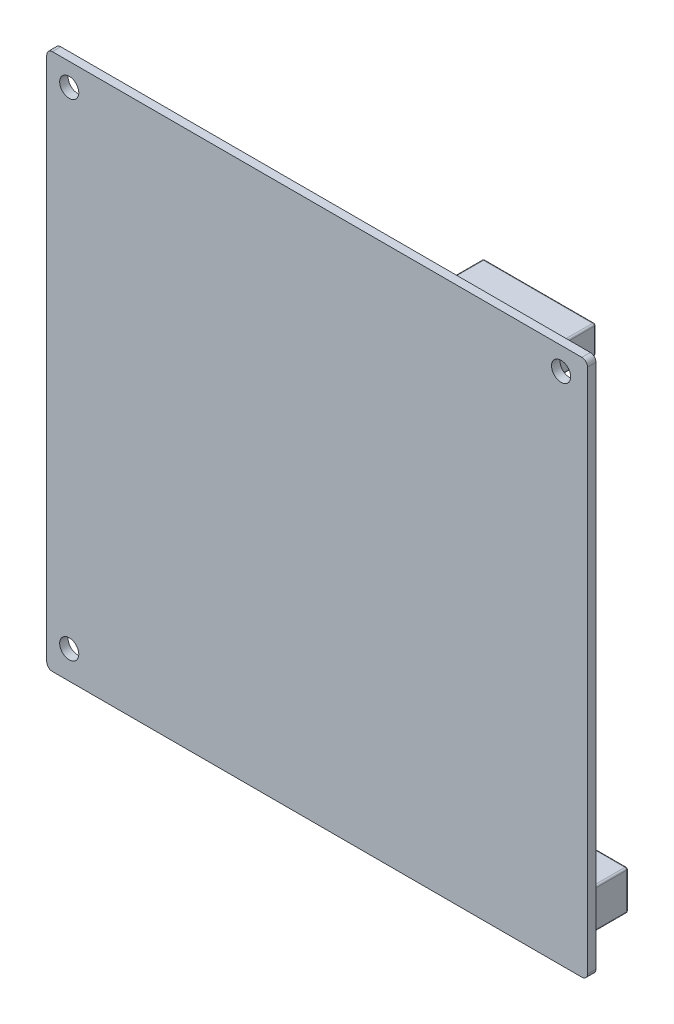
from build123d import *

# Parameters (mm, degrees)
SKETCH1_R           = 1.7
BOSS_EXTRUDE1_DEPTH = 1.5
SKETCH2_W           = 10
SKETCH2_H           = 7
BOSS_EXTRUDE2_DEPTH = 10
FILLET1_R           = 0.3
SKETCH3_R           = 3.5
SKETCH3_R_2         = 2.5
SKETCH3_W           = 5
SKETCH3_H           = 60
SKETCH3_W_2         = 20
SKETCH3_H_2         = 5
BOSS_EXTRUDE3_DEPTH = 10
FILLET2_R           = 0.3


with BuildPart() as part:
    # Sketch1 → Boss-Extrude1 (new body)
    with BuildSketch(Plane.XY):
        with BuildLine():
            Line((-47.1, 47.75), (47.1, 47.75))
            ThreePointArc((47.1, 47.75), (47.807106781, 47.457106781), (48.1, 46.75))
            Line((48.1, 46.75), (48.1, -46.75))
            ThreePointArc((48.1, -46.75), (47.807106781, -47.457106781), (47.1, -47.75))
            Line((47.1, -47.75), (-47.1, -47.75))
            ThreePointArc((-47.1, -47.75), (-47.807106781, -47.457106781), (-48.1, -46.75))
            Line((-48.1, -46.75), (-48.1, 46.75))
            ThreePointArc((-48.1, 46.75), (-47.807106781, 47.457106781), (-47.1, 47.75))
        make_face()
        with Locations((-44.1, 43.75)):
            Circle(SKETCH1_R, mode=Mode.SUBTRACT)
        with Locations((-44.1, -42.75)):
            Circle(SKETCH1_R, mode=Mode.SUBTRACT)
        with Locations((43.4, 43.75)):
            Circle(SKETCH1_R, mode=Mode.SUBTRACT)
    extrude(amount=BOSS_EXTRUDE1_DEPTH)

    # Sketch2 → Boss-Extrude2 (add)
    with BuildSketch(Plane(origin=(0, 0, 0), x_dir=(-1, 0, 0), z_dir=(0, 0, -1))):
        with Locations((-38.84642424, -41.693137568)):
            Rectangle(SKETCH2_W, SKETCH2_H)
    extrude(amount=BOSS_EXTRUDE2_DEPTH)

    # Fillet1
    fillet1_edges = [part.edges().sort_by_distance(p)[0] for p in [
        (43.84642424, -41.693137568, 0),
        (43.84642424, -38.193137568, -5),
        (38.84642424, -45.193137568, 0),
        (43.84642424, -45.193137568, -5),
        (33.84642424, -41.693137568, 0),
        (33.84642424, -45.193137568, -5),
        (38.84642424, -38.193137568, 0),
        (33.84642424, -38.193137568, -5),
        (43.84642424, -41.693137568, -10),
        (38.84642424, -45.193137568, -10),
        (33.84642424, -41.693137568, -10),
        (38.84642424, -38.193137568, -10),
    ]]
    fillet(fillet1_edges, radius=FILLET1_R)

    # Sketch3 → Boss-Extrude3 (add)
    with BuildSketch(Plane(origin=(0, 0, 0), x_dir=(-1, 0, 0), z_dir=(0, 0, -1))):
        with Locations(Location((-24.645786009, -38.910874107, 0), (0, 0, 180))):
            Circle(SKETCH3_R)
        with Locations(Location((-18.1, -38.910874107, 0), (0, 0, 180))):
            Circle(SKETCH3_R_2)
        with Locations((41.6, -2.25)):
            Rectangle(SKETCH3_W, SKETCH3_H)
        with Locations((-28.1, 40.25)):
            Rectangle(SKETCH3_W_2, SKETCH3_H_2)
        with Locations((-6.474280775, -41.410874107)):
            Rectangle(SKETCH3_W, SKETCH3_H_2)
    extrude(amount=BOSS_EXTRUDE3_DEPTH)

    # Fillet2
    # the kernel refuses this fillet: 0.3 mm, written as the material it adds along each edge
    with BuildSketch(Plane(origin=(24.645786009, -38.910874107, 0), x_dir=(1, 0, 0), z_dir=(0, 1, 0))) as fillet2_piece_1:
        with BuildLine():
            CenterArc((3.5 + FILLET2_R, FILLET2_R), FILLET2_R, 180, 90)
            Line((3.5, FILLET2_R), (3.5, 0))
            Line((3.5, 0), (3.5 + FILLET2_R, 0))
        make_face()
    revolve(axis=Axis((24.645786009, -38.910874107, 0), (0, 0, -1)))
    with BuildSketch(Plane(origin=(18.1, -38.910874107, 0), x_dir=(1, 0, 0), z_dir=(0, 1, 0))) as fillet2_piece_2:
        with BuildLine():
            CenterArc((2.5 + FILLET2_R, FILLET2_R), FILLET2_R, 180, 90)
            Line((2.5, FILLET2_R), (2.5, 0))
            Line((2.5, 0), (2.5 + FILLET2_R, 0))
        make_face()
    revolve(axis=Axis((18.1, -38.910874107, 0), (0, 0, -1)))
    # the kernel refuses this fillet: 0.3 mm, written as the material it takes off along each edge
    with BuildSketch(Plane(origin=(-39.4, 27.45, -9.7), x_dir=(0, 1, 0), z_dir=(1, 0, 0))) as fillet2_2_piece_1_section:
        Polygon((0, 0), (FILLET2_R, 0), (FILLET2_R, -FILLET2_R), (0, -FILLET2_R), align=None)
    fillet2_2_piece_1 = extrude(amount=FILLET2_R, mode=Mode.PRIVATE)
    fillet2_2_piece_1 = fillet2_2_piece_1 - Plane(origin=(-39.4, 27.45, -9.7), x_dir=(0, -0.7071067811865475, 0.7071067811865475), z_dir=(1, 0, 0)) * Sphere(FILLET2_R, mode=Mode.PRIVATE)
    add(fillet2_2_piece_1, mode=Mode.SUBTRACT)
    with BuildSketch(Plane(origin=(-39.4, -31.95, -9.7), x_dir=(0, -1, 0), z_dir=(1, 0, 0))) as fillet2_2_piece_2_section:
        Polygon((0, 0), (FILLET2_R, 0), (FILLET2_R, FILLET2_R), (0, FILLET2_R), align=None)
    fillet2_2_piece_2 = extrude(amount=FILLET2_R, mode=Mode.PRIVATE)
    fillet2_2_piece_2 = fillet2_2_piece_2 - Plane(origin=(-39.4, -31.95, -9.7), x_dir=(0, 0.7071067811865475, 0.7071067811865475), z_dir=(1, 0, 0)) * Sphere(FILLET2_R, mode=Mode.PRIVATE)
    add(fillet2_2_piece_2, mode=Mode.SUBTRACT)
    with BuildSketch(Plane(origin=(-43.8, -31.95, -9.7), x_dir=(-1, 0, 0), z_dir=(0, -1, 0))) as fillet2_2_piece_3_section:
        Polygon((0, 0), (FILLET2_R, 0), (FILLET2_R, FILLET2_R), (0, FILLET2_R), align=None)
    fillet2_2_piece_3 = extrude(amount=FILLET2_R, mode=Mode.PRIVATE)
    fillet2_2_piece_3 = fillet2_2_piece_3 - Plane(origin=(-43.8, -31.95, -9.7), x_dir=(0.7071067811865475, 0, 0.7071067811865475), z_dir=(0, -1, 0)) * Sphere(FILLET2_R, mode=Mode.PRIVATE)
    add(fillet2_2_piece_3, mode=Mode.SUBTRACT)
    with BuildSketch(Plane(origin=(-43.8, 27.45, -9.7), x_dir=(-1, 0, 0), z_dir=(0, 1, 0))) as fillet2_2_piece_4_section:
        Polygon((0, 0), (FILLET2_R, 0), (FILLET2_R, -FILLET2_R), (0, -FILLET2_R), align=None)
    fillet2_2_piece_4 = extrude(amount=FILLET2_R, mode=Mode.PRIVATE)
    fillet2_2_piece_4 = fillet2_2_piece_4 - Plane(origin=(-43.8, 27.45, -9.7), x_dir=(0.7071067811865475, 0, 0.7071067811865475), z_dir=(0, 1, 0)) * Sphere(FILLET2_R, mode=Mode.PRIVATE)
    add(fillet2_2_piece_4, mode=Mode.SUBTRACT)
    with BuildSketch(Plane(origin=(37.8, 42.45, -9.7), x_dir=(1, 0, 0), z_dir=(0, 0, -1))) as fillet2_2_piece_5_section:
        Polygon((0, 0), (FILLET2_R, 0), (FILLET2_R, -FILLET2_R), (0, -FILLET2_R), align=None)
    fillet2_2_piece_5 = extrude(amount=FILLET2_R, mode=Mode.PRIVATE)
    fillet2_2_piece_5 = fillet2_2_piece_5 - Plane(origin=(37.8, 42.45, -9.7), x_dir=(-0.7071067811865475, -0.7071067811865475, 0), z_dir=(0, 0, -1)) * Sphere(FILLET2_R, mode=Mode.PRIVATE)
    add(fillet2_2_piece_5, mode=Mode.SUBTRACT)
    with BuildSketch(Plane(origin=(37.8, 38.05, -9.7), x_dir=(0, -1, 0), z_dir=(1, 0, 0))) as fillet2_2_piece_6_section:
        Polygon((0, 0), (FILLET2_R, 0), (FILLET2_R, FILLET2_R), (0, FILLET2_R), align=None)
    fillet2_2_piece_6 = extrude(amount=FILLET2_R, mode=Mode.PRIVATE)
    fillet2_2_piece_6 = fillet2_2_piece_6 - Plane(origin=(37.8, 38.05, -9.7), x_dir=(0, 0.7071067811865475, 0.7071067811865475), z_dir=(1, 0, 0)) * Sphere(FILLET2_R, mode=Mode.PRIVATE)
    add(fillet2_2_piece_6, mode=Mode.SUBTRACT)
    with BuildSketch(Plane(origin=(18.4, 38.05, -9.7), x_dir=(0, -1, 0), z_dir=(-1, 0, 0))) as fillet2_2_piece_7_section:
        Polygon((0, 0), (FILLET2_R, 0), (FILLET2_R, -FILLET2_R), (0, -FILLET2_R), align=None)
    fillet2_2_piece_7 = extrude(amount=FILLET2_R, mode=Mode.PRIVATE)
    fillet2_2_piece_7 = fillet2_2_piece_7 - Plane(origin=(18.4, 38.05, -9.7), x_dir=(0, 0.7071067811865475, 0.7071067811865475), z_dir=(-1, 0, 0)) * Sphere(FILLET2_R, mode=Mode.PRIVATE)
    add(fillet2_2_piece_7, mode=Mode.SUBTRACT)
    with BuildSketch(Plane(origin=(18.4, 42.45, -9.7), x_dir=(0, 0, -1), z_dir=(-1, 0, 0))) as fillet2_2_piece_8_section:
        Polygon((0, 0), (FILLET2_R, 0), (FILLET2_R, -FILLET2_R), (0, -FILLET2_R), align=None)
    fillet2_2_piece_8 = extrude(amount=FILLET2_R, mode=Mode.PRIVATE)
    fillet2_2_piece_8 = fillet2_2_piece_8 - Plane(origin=(18.4, 42.45, -9.7), x_dir=(0, -0.7071067811865475, 0.7071067811865475), z_dir=(-1, 0, 0)) * Sphere(FILLET2_R, mode=Mode.PRIVATE)
    add(fillet2_2_piece_8, mode=Mode.SUBTRACT)
    with BuildSketch(Plane(origin=(8.674280775, -39.210874107, -9.7), x_dir=(1, 0, 0), z_dir=(0, 0, -1))) as fillet2_2_piece_9_section:
        Polygon((0, 0), (FILLET2_R, 0), (FILLET2_R, -FILLET2_R), (0, -FILLET2_R), align=None)
    fillet2_2_piece_9 = extrude(amount=FILLET2_R, mode=Mode.PRIVATE)
    fillet2_2_piece_9 = fillet2_2_piece_9 - Plane(origin=(8.674280775, -39.210874107, -9.7), x_dir=(-0.7071067811865475, -0.7071067811865475, 0), z_dir=(0, 0, -1)) * Sphere(FILLET2_R, mode=Mode.PRIVATE)
    add(fillet2_2_piece_9, mode=Mode.SUBTRACT)
    with BuildSketch(Plane(origin=(8.674280775, -43.610874107, -9.7), x_dir=(0, -1, 0), z_dir=(1, 0, 0))) as fillet2_2_piece_10_section:
        Polygon((0, 0), (FILLET2_R, 0), (FILLET2_R, FILLET2_R), (0, FILLET2_R), align=None)
    fillet2_2_piece_10 = extrude(amount=FILLET2_R, mode=Mode.PRIVATE)
    fillet2_2_piece_10 = fillet2_2_piece_10 - Plane(origin=(8.674280775, -43.610874107, -9.7), x_dir=(0, 0.7071067811865475, 0.7071067811865475), z_dir=(1, 0, 0)) * Sphere(FILLET2_R, mode=Mode.PRIVATE)
    add(fillet2_2_piece_10, mode=Mode.SUBTRACT)
    with BuildSketch(Plane(origin=(4.274280775, -43.610874107, -9.7), x_dir=(0, 0, -1), z_dir=(0, -1, 0))) as fillet2_2_piece_11_section:
        Polygon((0, 0), (FILLET2_R, 0), (FILLET2_R, -FILLET2_R), (0, -FILLET2_R), align=None)
    fillet2_2_piece_11 = extrude(amount=FILLET2_R, mode=Mode.PRIVATE)
    fillet2_2_piece_11 = fillet2_2_piece_11 - Plane(origin=(4.274280775, -43.610874107, -9.7), x_dir=(0.7071067811865475, 0, 0.7071067811865475), z_dir=(0, -1, 0)) * Sphere(FILLET2_R, mode=Mode.PRIVATE)
    add(fillet2_2_piece_11, mode=Mode.SUBTRACT)
    with BuildSketch(Plane(origin=(4.274280775, -39.210874107, -9.7), x_dir=(0, 1, 0), z_dir=(0, 0, -1))) as fillet2_2_piece_12_section:
        Polygon((0, 0), (FILLET2_R, 0), (FILLET2_R, -FILLET2_R), (0, -FILLET2_R), align=None)
    fillet2_2_piece_12 = extrude(amount=FILLET2_R, mode=Mode.PRIVATE)
    fillet2_2_piece_12 = fillet2_2_piece_12 - Plane(origin=(4.274280775, -39.210874107, -9.7), x_dir=(0.7071067811865475, -0.7071067811865477, 0), z_dir=(0, 0, -1)) * Sphere(FILLET2_R, mode=Mode.PRIVATE)
    add(fillet2_2_piece_12, mode=Mode.SUBTRACT)
    with BuildSketch(Plane(origin=(-39.1, 27.75, 0), x_dir=(0, -1, 0), z_dir=(0, 0, -1)), Plane(origin=(-44.1, 27.75, 0), x_dir=(1, 0, 0), z_dir=(0, 0, -1)), Plane(origin=(38.1, 42.75, 0), x_dir=(0, -1, 0), z_dir=(0, 0, -1)), Plane(origin=(18.1, 42.75, 0), x_dir=(1, 0, 0), z_dir=(0, 0, -1)), Plane(origin=(8.974280775, -38.910874107, 0), x_dir=(0, -1, 0), z_dir=(0, 0, -1)), Plane(origin=(3.974280775, -38.910874107, 0), x_dir=(1, 0, 0), z_dir=(0, 0, -1))) as fillet2_2_piece_13:
        with BuildLine():
            CenterArc((FILLET2_R, FILLET2_R), FILLET2_R, 180, 90)
            Line((0, FILLET2_R), (0, 0))
            Line((0, 0), (FILLET2_R, 0))
        make_face()
    extrude(amount=9.7, mode=Mode.SUBTRACT)
    with BuildSketch(Plane(origin=(-39.1, -32.25, 0), x_dir=(0, 1, 0), z_dir=(0, 0, -1)), Plane(origin=(-44.1, -32.25, 0), x_dir=(1, 0, 0), z_dir=(0, 0, -1)), Plane(origin=(38.1, 37.75, 0), x_dir=(0, 1, 0), z_dir=(0, 0, -1)), Plane(origin=(18.1, 37.75, 0), x_dir=(1, 0, 0), z_dir=(0, 0, -1)), Plane(origin=(8.974280775, -43.910874107, 0), x_dir=(0, 1, 0), z_dir=(0, 0, -1)), Plane(origin=(3.974280775, -43.910874107, 0), x_dir=(1, 0, 0), z_dir=(0, 0, -1))) as fillet2_2_piece_14:
        with BuildLine():
            CenterArc((FILLET2_R, -FILLET2_R), FILLET2_R, 90, 90)
            Line((0, -FILLET2_R), (0, 0))
            Line((0, 0), (FILLET2_R, 0))
        make_face()
    extrude(amount=9.7, mode=Mode.SUBTRACT)
    with BuildSketch(Plane(origin=(-39.1, -31.95, -10), x_dir=(0, 0, 1), z_dir=(0, 1, 0)), Plane(origin=(-44.1, 27.45, -10), x_dir=(0, 0, 1), z_dir=(0, -1, 0))) as fillet2_2_piece_15:
        with BuildLine():
            CenterArc((FILLET2_R, -FILLET2_R), FILLET2_R, 90, 90)
            Line((0, -FILLET2_R), (0, 0))
            Line((0, 0), (FILLET2_R, 0))
        make_face()
    extrude(amount=59.4, mode=Mode.SUBTRACT)
    with BuildSketch(Plane(origin=(-43.8, -32.25, -10), x_dir=(0, 0, 1), z_dir=(1, 0, 0)), Plane(origin=(-39.4, 27.75, -10), x_dir=(0, 0, 1), z_dir=(-1, 0, 0)), Plane(origin=(38.1, 38.05, -10), x_dir=(0, 0, 1), z_dir=(0, 1, 0)), Plane(origin=(18.1, 42.45, -10), x_dir=(0, 0, 1), z_dir=(0, -1, 0)), Plane(origin=(8.974280775, -43.610874107, -10), x_dir=(0, 0, 1), z_dir=(0, 1, 0)), Plane(origin=(4.274280775, -43.910874107, -10), x_dir=(0, 0, 1), z_dir=(1, 0, 0)), Plane(origin=(3.974280775, -39.210874107, -10), x_dir=(0, 0, 1), z_dir=(0, -1, 0)), Plane(origin=(8.674280775, -38.910874107, -10), x_dir=(0, 0, 1), z_dir=(-1, 0, 0))) as fillet2_2_piece_16:
        with BuildLine():
            CenterArc((FILLET2_R, -FILLET2_R), FILLET2_R, 90, 90)
            Line((0, -FILLET2_R), (0, 0))
            Line((0, 0), (FILLET2_R, 0))
        make_face()
    extrude(amount=4.4, mode=Mode.SUBTRACT)
    with BuildSketch(Plane(origin=(18.4, 37.75, -10), x_dir=(0, 0, 1), z_dir=(1, 0, 0)), Plane(origin=(37.8, 42.75, -10), x_dir=(0, 0, 1), z_dir=(-1, 0, 0))) as fillet2_2_piece_17:
        with BuildLine():
            CenterArc((FILLET2_R, -FILLET2_R), FILLET2_R, 90, 90)
            Line((0, -FILLET2_R), (0, 0))
            Line((0, 0), (FILLET2_R, 0))
        make_face()
    extrude(amount=19.4, mode=Mode.SUBTRACT)
    with BuildSketch(Plane(origin=(24.645786009, -38.910874107, -10), x_dir=(1, 0, 0), z_dir=(0, 1, 0))) as fillet2_2_piece_18:
        with BuildLine():
            CenterArc((3.5 - FILLET2_R, -FILLET2_R), FILLET2_R, 0, 90)
            Line((3.5 - FILLET2_R, 0), (3.5, 0))
            Line((3.5, 0), (3.5, -FILLET2_R))
        make_face()
    revolve(axis=Axis((24.645786009, -38.910874107, -10), (0, 0, -1)), mode=Mode.SUBTRACT)
    with BuildSketch(Plane(origin=(18.1, -38.910874107, -10), x_dir=(1, 0, 0), z_dir=(0, 1, 0))) as fillet2_2_piece_19:
        with BuildLine():
            CenterArc((2.5 - FILLET2_R, -FILLET2_R), FILLET2_R, 0, 90)
            Line((2.5 - FILLET2_R, 0), (2.5, 0))
            Line((2.5, 0), (2.5, -FILLET2_R))
        make_face()
    revolve(axis=Axis((18.1, -38.910874107, -10), (0, 0, -1)), mode=Mode.SUBTRACT)
    # the kernel refuses this fillet: 0.3 mm, written as the material it adds along each edge
    with BuildSketch(Plane(origin=(-39.1, -31.95, 0), x_dir=(1, 0, 0), z_dir=(0, 1, 0)), Plane(origin=(-44.1, 27.45, 0), x_dir=(-1, 0, 0), z_dir=(0, -1, 0))) as fillet2_3_piece_1:
        with BuildLine():
            CenterArc((FILLET2_R, FILLET2_R), FILLET2_R, 180, 90)
            Line((0, FILLET2_R), (0, 0))
            Line((0, 0), (FILLET2_R, 0))
        make_face()
    extrude(amount=59.4)
    with BuildSketch(Plane(origin=(-43.8, -32.25, 0), x_dir=(0, -1, 0), z_dir=(1, 0, 0)), Plane(origin=(-39.4, 27.75, 0), x_dir=(0, 1, 0), z_dir=(-1, 0, 0)), Plane(origin=(38.1, 38.05, 0), x_dir=(1, 0, 0), z_dir=(0, 1, 0)), Plane(origin=(18.1, 42.45, 0), x_dir=(-1, 0, 0), z_dir=(0, -1, 0)), Plane(origin=(8.974280775, -43.610874107, 0), x_dir=(1, 0, 0), z_dir=(0, 1, 0)), Plane(origin=(4.274280775, -43.910874107, 0), x_dir=(0, -1, 0), z_dir=(1, 0, 0)), Plane(origin=(3.974280775, -39.210874107, 0), x_dir=(-1, 0, 0), z_dir=(0, -1, 0)), Plane(origin=(8.674280775, -38.910874107, 0), x_dir=(0, 1, 0), z_dir=(-1, 0, 0))) as fillet2_3_piece_2:
        with BuildLine():
            CenterArc((FILLET2_R, FILLET2_R), FILLET2_R, 180, 90)
            Line((0, FILLET2_R), (0, 0))
            Line((0, 0), (FILLET2_R, 0))
        make_face()
    extrude(amount=4.4)
    with BuildSketch(Plane(origin=(18.4, 37.75, 0), x_dir=(0, -1, 0), z_dir=(1, 0, 0)), Plane(origin=(37.8, 42.75, 0), x_dir=(0, 1, 0), z_dir=(-1, 0, 0))) as fillet2_3_piece_3:
        with BuildLine():
            CenterArc((FILLET2_R, FILLET2_R), FILLET2_R, 180, 90)
            Line((0, FILLET2_R), (0, 0))
            Line((0, 0), (FILLET2_R, 0))
        make_face()
    extrude(amount=19.4)
    with BuildSketch(Plane(origin=(8.674280775, -39.210874107, 0), x_dir=(1, 0, 0), z_dir=(0, -1, 0))) as fillet2_3_piece_4:
        with BuildLine():
            CenterArc((0.3 + FILLET2_R, -FILLET2_R), FILLET2_R, 90, 90)
            Line((0.3, -FILLET2_R), (0.3, 0))
            Line((0.3, 0), (0.3 + FILLET2_R, 0))
        make_face()
    revolve(axis=Axis((8.674280775, -39.210874107, 0), (0, 0, 1)), revolution_arc=90)
    with BuildSketch(Plane(origin=(4.274280775, -39.210874107, 0), x_dir=(0, 1, 0), z_dir=(1, 0, 0))) as fillet2_3_piece_5:
        with BuildLine():
            CenterArc((0.3 + FILLET2_R, -FILLET2_R), FILLET2_R, 90, 90)
            Line((0.3, -FILLET2_R), (0.3, 0))
            Line((0.3, 0), (0.3 + FILLET2_R, 0))
        make_face()
    revolve(axis=Axis((4.274280775, -39.210874107, 0), (0, 0, 1)), revolution_arc=90)
    with BuildSketch(Plane(origin=(4.274280775, -43.610874107, 0), x_dir=(0, -1, 0), z_dir=(1, 0, 0))) as fillet2_3_piece_6:
        with BuildLine():
            CenterArc((0.3 + FILLET2_R, FILLET2_R), FILLET2_R, 180, 90)
            Line((0.3, FILLET2_R), (0.3, 0))
            Line((0.3, 0), (0.3 + FILLET2_R, 0))
        make_face()
    revolve(axis=Axis((4.274280775, -43.610874107, 0), (0, 0, -1)), revolution_arc=90)
    with BuildSketch(Plane(origin=(8.674280775, -43.610874107, 0), x_dir=(1, 0, 0), z_dir=(0, 1, 0))) as fillet2_3_piece_7:
        with BuildLine():
            CenterArc((0.3 + FILLET2_R, FILLET2_R), FILLET2_R, 180, 90)
            Line((0.3, FILLET2_R), (0.3, 0))
            Line((0.3, 0), (0.3 + FILLET2_R, 0))
        make_face()
    revolve(axis=Axis((8.674280775, -43.610874107, 0), (0, 0, -1)), revolution_arc=90)
    with BuildSketch(Plane(origin=(37.8, 42.45, 0), x_dir=(1, 0, 0), z_dir=(0, -1, 0))) as fillet2_3_piece_8:
        with BuildLine():
            CenterArc((0.3 + FILLET2_R, -FILLET2_R), FILLET2_R, 90, 90)
            Line((0.3, -FILLET2_R), (0.3, 0))
            Line((0.3, 0), (0.3 + FILLET2_R, 0))
        make_face()
    revolve(axis=Axis((37.8, 42.45, 0), (0, 0, 1)), revolution_arc=90)
    with BuildSketch(Plane(origin=(18.4, 42.45, 0), x_dir=(0, 1, 0), z_dir=(1, 0, 0))) as fillet2_3_piece_9:
        with BuildLine():
            CenterArc((0.3 + FILLET2_R, -FILLET2_R), FILLET2_R, 90, 90)
            Line((0.3, -FILLET2_R), (0.3, 0))
            Line((0.3, 0), (0.3 + FILLET2_R, 0))
        make_face()
    revolve(axis=Axis((18.4, 42.45, 0), (0, 0, 1)), revolution_arc=90)
    with BuildSketch(Plane(origin=(18.4, 38.05, 0), x_dir=(0, -1, 0), z_dir=(1, 0, 0))) as fillet2_3_piece_10:
        with BuildLine():
            CenterArc((0.3 + FILLET2_R, FILLET2_R), FILLET2_R, 180, 90)
            Line((0.3, FILLET2_R), (0.3, 0))
            Line((0.3, 0), (0.3 + FILLET2_R, 0))
        make_face()
    revolve(axis=Axis((18.4, 38.05, 0), (0, 0, -1)), revolution_arc=90)
    with BuildSketch(Plane(origin=(37.8, 38.05, 0), x_dir=(1, 0, 0), z_dir=(0, 1, 0))) as fillet2_3_piece_11:
        with BuildLine():
            CenterArc((0.3 + FILLET2_R, FILLET2_R), FILLET2_R, 180, 90)
            Line((0.3, FILLET2_R), (0.3, 0))
            Line((0.3, 0), (0.3 + FILLET2_R, 0))
        make_face()
    revolve(axis=Axis((37.8, 38.05, 0), (0, 0, -1)), revolution_arc=90)
    with BuildSketch(Plane(origin=(-39.4, 27.45, 0), x_dir=(1, 0, 0), z_dir=(0, -1, 0))) as fillet2_3_piece_12:
        with BuildLine():
            CenterArc((0.3 + FILLET2_R, -FILLET2_R), FILLET2_R, 90, 90)
            Line((0.3, -FILLET2_R), (0.3, 0))
            Line((0.3, 0), (0.3 + FILLET2_R, 0))
        make_face()
    revolve(axis=Axis((-39.4, 27.45, 0), (0, 0, 1)), revolution_arc=90)
    with BuildSketch(Plane(origin=(-43.8, 27.45, 0), x_dir=(0, 1, 0), z_dir=(1, 0, 0))) as fillet2_3_piece_13:
        with BuildLine():
            CenterArc((0.3 + FILLET2_R, -FILLET2_R), FILLET2_R, 90, 90)
            Line((0.3, -FILLET2_R), (0.3, 0))
            Line((0.3, 0), (0.3 + FILLET2_R, 0))
        make_face()
    revolve(axis=Axis((-43.8, 27.45, 0), (0, 0, 1)), revolution_arc=90)
    with BuildSketch(Plane(origin=(-43.8, -31.95, 0), x_dir=(0, -1, 0), z_dir=(1, 0, 0))) as fillet2_3_piece_14:
        with BuildLine():
            CenterArc((0.3 + FILLET2_R, FILLET2_R), FILLET2_R, 180, 90)
            Line((0.3, FILLET2_R), (0.3, 0))
            Line((0.3, 0), (0.3 + FILLET2_R, 0))
        make_face()
    revolve(axis=Axis((-43.8, -31.95, 0), (0, 0, -1)), revolution_arc=90)
    with BuildSketch(Plane(origin=(-39.4, -31.95, 0), x_dir=(1, 0, 0), z_dir=(0, 1, 0))) as fillet2_3_piece_15:
        with BuildLine():
            CenterArc((0.3 + FILLET2_R, FILLET2_R), FILLET2_R, 180, 90)
            Line((0.3, FILLET2_R), (0.3, 0))
            Line((0.3, 0), (0.3 + FILLET2_R, 0))
        make_face()
    revolve(axis=Axis((-39.4, -31.95, 0), (0, 0, -1)), revolution_arc=90)


solid = part.part
